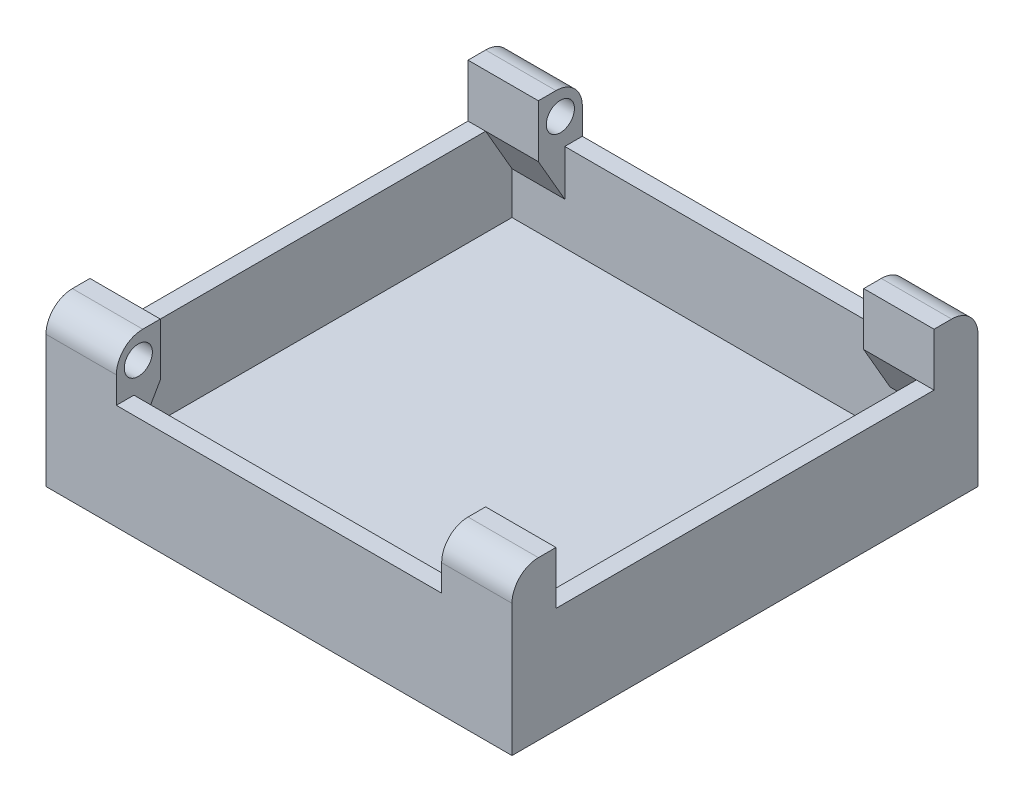
from build123d import *
from OCP.BRepFilletAPI import BRepFilletAPI_MakeChamfer

# Parameters (mm, degrees)
SKETCH1_W               = 53
SKETCH1_H               = 53
SKETCH1_W_2             = 49
SKETCH1_H_2             = 49
BOSS_EXTRUDE1_DEPTH     = 10
SKETCH2_W               = 53
SKETCH2_H               = 53
BOSS_EXTRUDE2_DEPTH     = 2
SKETCH3_W               = 8
SKETCH3_H               = 5
BOSS_EXTRUDE3_DEPTH     = 6
CHAMFER3_SIZE           = 5.196152423
CHAMFER3_SIZE_2         = 3
CUT_EXTRUDE1_DEPTH      = 22
CUT_EXTRUDE1_DEPTH_BACK = 22
SKETCH4_R               = 1.6
FILLET3_R               = 3


with BuildPart() as part:
    # Sketch1 → Boss-Extrude1 (new body)
    with BuildSketch(Plane(origin=(0, 0, 0), x_dir=(1, 0, 0), z_dir=(0, 1, 0))):
        Rectangle(SKETCH1_W, SKETCH1_H)
        Rectangle(SKETCH1_W_2, SKETCH1_H_2, mode=Mode.SUBTRACT)
    extrude(amount=BOSS_EXTRUDE1_DEPTH)

    # Sketch2 → Boss-Extrude2 (add)
    with BuildSketch(Plane.XZ):
        Rectangle(SKETCH2_W, SKETCH2_H)
    extrude(amount=BOSS_EXTRUDE2_DEPTH)

    # Sketch3 → Boss-Extrude3 (add)
    with BuildSketch(Plane(origin=(0, 10, 0), x_dir=(1, 0, 0), z_dir=(0, 1, 0))):
        with Locations((-22.5, -24)):
            Rectangle(SKETCH3_W, SKETCH3_H)
        with Locations((22.5, -24)):
            Rectangle(SKETCH3_W, SKETCH3_H)
        with Locations((22.5, 24)):
            Rectangle(SKETCH3_W, SKETCH3_H)
        with Locations((-22.5, 24)):
            Rectangle(SKETCH3_W, SKETCH3_H)
    extrude(amount=BOSS_EXTRUDE3_DEPTH)

    # Chamfer3
    chamfer3_edges_1 = [part.edges().sort_by_distance(p)[0] for p in [
        (-21.5, 10, -24.5),
    ]]
    chamfer3_side_1 = [part.faces().sort_by_distance(p)[0] for p in [
        (-21.5, 9.94, -24.5),
    ]]
    chamfer3_edges_2 = [part.edges().sort_by_distance(p)[0] for p in [
        (-21.5, 10, 24.5),
    ]]
    chamfer3_side_2 = [part.faces().sort_by_distance(p)[0] for p in [
        (-21.5, 10, 24.44),
    ]]
    chamfer3_edges_3 = [part.edges().sort_by_distance(p)[0] for p in [
        (21.5, 10, 24.5),
    ]]
    chamfer3_side_3 = [part.faces().sort_by_distance(p)[0] for p in [
        (21.5, 9.94, 24.5),
    ]]
    chamfer3_edges_4 = [part.edges().sort_by_distance(p)[0] for p in [
        (21.5, 10, -24.5),
    ]]
    chamfer3_side_4 = [part.faces().sort_by_distance(p)[0] for p in [
        (21.5, 10, -24.44),
    ]]
    chamfer3 = BRepFilletAPI_MakeChamfer(part.part.solid().wrapped)
    for e in chamfer3_edges_1:
        chamfer3.Add(CHAMFER3_SIZE - 0.0001, CHAMFER3_SIZE_2 - 0.0001, e.wrapped, chamfer3_side_1[0].wrapped)
    for e in chamfer3_edges_2:
        chamfer3.Add(CHAMFER3_SIZE_2 - 0.0001, CHAMFER3_SIZE - 0.0001, e.wrapped, chamfer3_side_2[0].wrapped)
    for e in chamfer3_edges_3:
        chamfer3.Add(CHAMFER3_SIZE - 0.0001, CHAMFER3_SIZE_2 - 0.0001, e.wrapped, chamfer3_side_3[0].wrapped)
    for e in chamfer3_edges_4:
        chamfer3.Add(CHAMFER3_SIZE_2 - 0.0001, CHAMFER3_SIZE - 0.0001, e.wrapped, chamfer3_side_4[0].wrapped)
    add(Compound.cast(chamfer3.Shape()), mode=Mode.REPLACE)  # a hair under: the kernel refuses the full size

    # Sketch4 → Cut-Extrude1 (cut, two sides: drawn at the far end of the back side and taken through both)
    with BuildSketch(Plane(origin=(0, 0, 0), x_dir=(0, 0, -1), z_dir=(1, 0, 0)).offset(-CUT_EXTRUDE1_DEPTH_BACK)):
        with Locations((-24, 13.2)):
            Circle(SKETCH4_R)
        with Locations(Location((24, 13.2, 0), (0, 0, 180))):
            Circle(SKETCH4_R)
    extrude(amount=CUT_EXTRUDE1_DEPTH + CUT_EXTRUDE1_DEPTH_BACK, mode=Mode.SUBTRACT)

    # Fillet3
    fillet3_edges = [part.edges().sort_by_distance(p)[0] for p in [
        (-22.5, 16, 26.5),
        (22.5, 16, 26.5),
        (22.5, 16, -26.5),
        (-22.5, 16, -26.5),
    ]]
    fillet(fillet3_edges, radius=FILLET3_R)


solid = part.part
